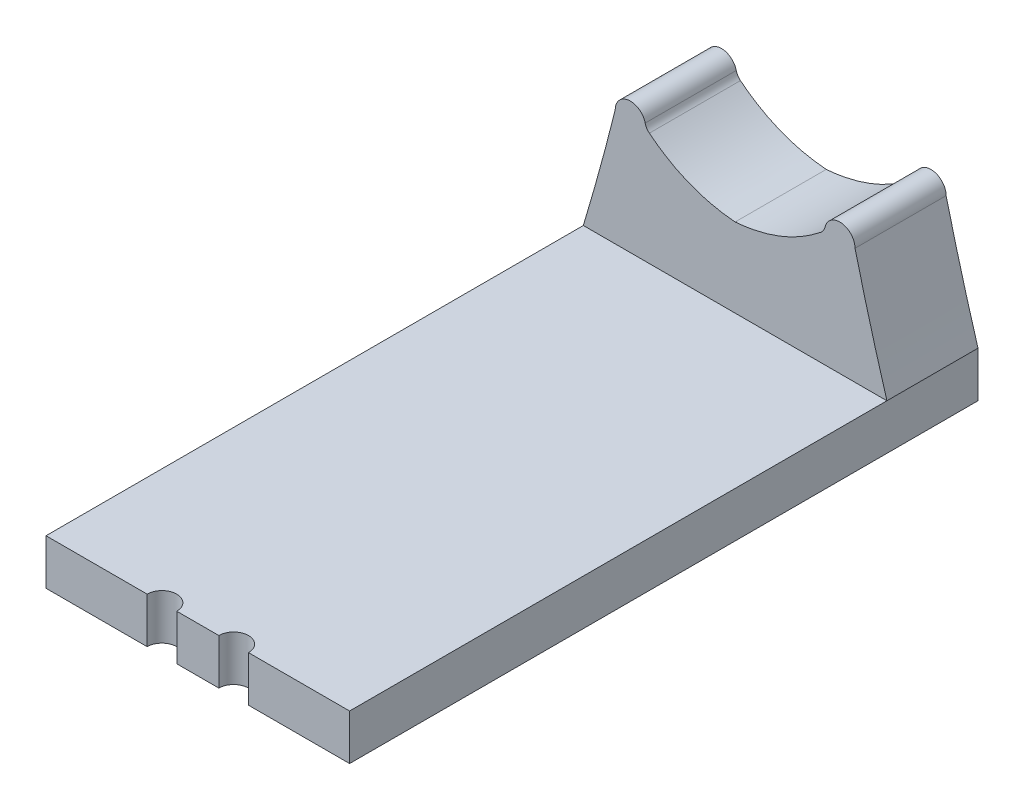
from build123d import *

# Parameters (mm, degrees)
BOSS_EXTRUDE1_DEPTH = 9.525
SKETCH2_W           = 63.5
SKETCH2_H           = 9.525
BOSS_EXTRUDE2_DEPTH = 121.92
FILLET2_R           = 2.54
SKETCH3_R           = 3.1
CUT_EXTRUDE1_DEPTH  = 129.944196595


with BuildPart() as part:
    # Sketch1 → Boss-Extrude1 (new, symmetric)
    with BuildSketch(Plane.XY):
        with BuildLine():
            Line((-31.75, -62.23), (-31.75, -71.755))
            Line((-31.75, -71.755), (31.75, -71.755))
            Line((31.75, -71.755), (31.75, -62.23))
            add(Edge.make_bspline(
                [(25.0825, -37.944903067), (28.120194167, -50.166960459), (31.75, -62.23)],
                knots=[0, 0, 0, 1, 1, 1], degree=2))
            ThreePointArc((25.0825, -37.944903067), (21.9075, -34.769903067), (18.7325, -37.944903067))
            add(Edge.make_bspline(
                [(18.7325, -37.944903067), (10.633340365, -44.866866243), (0, -45.72)],
                knots=[0, 0, 0, 1, 1, 1], degree=2))
            add(Edge.make_bspline(
                [(-18.7325, -37.944903067), (-10.633340365, -44.866866243), (0, -45.72)],
                knots=[0, 0, 0, 1, 1, 1], degree=2))
            ThreePointArc((-18.7325, -37.944903067), (-21.9075, -34.769903067), (-25.0825, -37.944903067))
            add(Edge.make_bspline(
                [(-25.0825, -37.944903067), (-28.120194167, -50.166960459), (-31.75, -62.23)],
                knots=[0, 0, 0, 1, 1, 1], degree=2))
        make_face()
    extrude(amount=BOSS_EXTRUDE1_DEPTH, both=True)

    # Sketch2 → Boss-Extrude2 (add)
    with BuildSketch(Plane.XY):
        with Locations((0, -66.9925)):
            Rectangle(SKETCH2_W, SKETCH2_H)
    extrude(amount=BOSS_EXTRUDE2_DEPTH)

    # Fillet2
    fillet2_edges = [part.edges().sort_by_distance(p)[0] for p in [
        (18.7325, -37.944903067, 4.7625),
        (-18.7325, -37.944903067, -4.7625),
    ]]
    fillet(fillet2_edges, radius=FILLET2_R)

    # Sketch3 → Cut-Extrude1 (cut, through all)
    with BuildSketch(Plane(origin=(0, -62.23, 0), x_dir=(1, 0, 0), z_dir=(0, 1, 0))):
        with Locations((7.5, -121.92)):
            Circle(SKETCH3_R)
        with Locations((-7.5, -121.92)):
            Circle(SKETCH3_R)
    extrude(amount=-CUT_EXTRUDE1_DEPTH, mode=Mode.SUBTRACT)


solid = part.part
